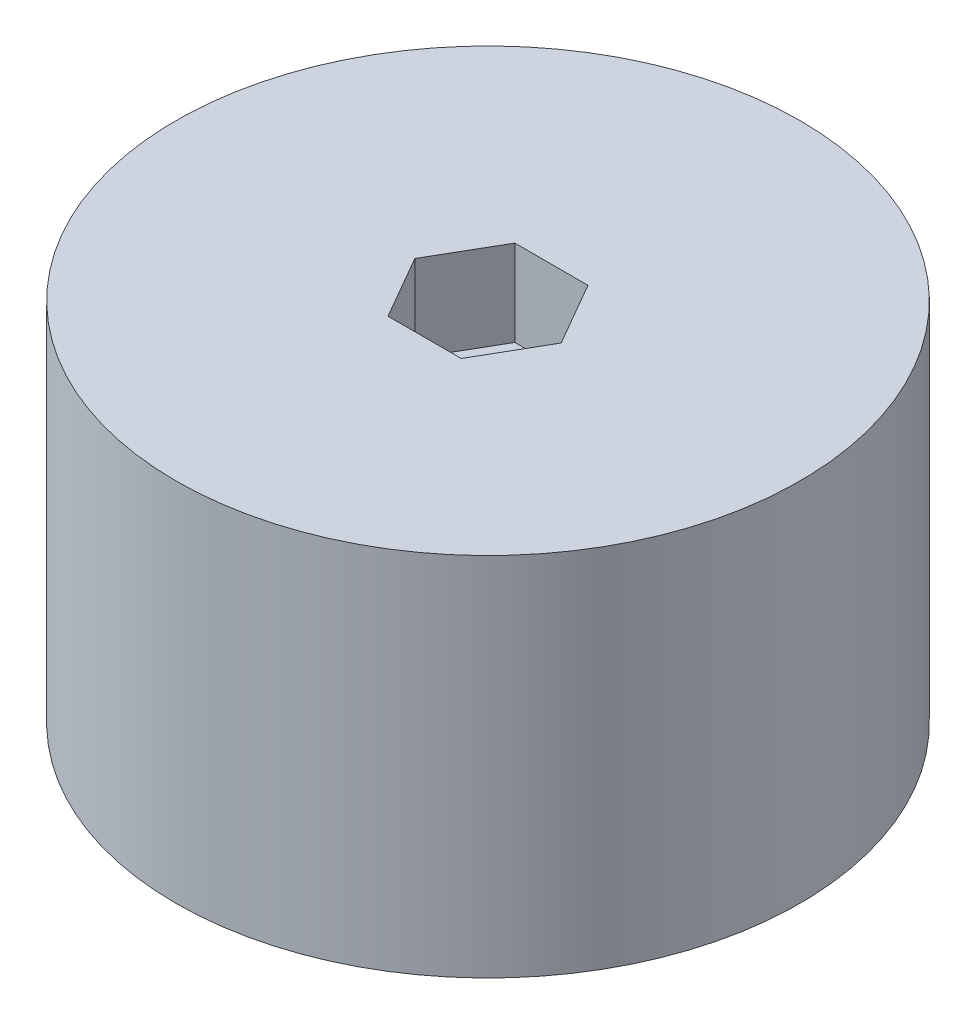
from build123d import *

# Parameters (mm, degrees)
SKETCH1_R           = 21.75
SKETCH1_R_2         = 3
BOSS_EXTRUDE1_DEPTH = 25.5
CUT_EXTRUDE1_DEPTH  = 6


with BuildPart() as part:
    # Sketch1 → Boss-Extrude1 (new body)
    with BuildSketch(Plane(origin=(0, 0, 0), x_dir=(1, 0, 0), z_dir=(0, 1, 0))):
        Circle(SKETCH1_R)
        Circle(SKETCH1_R_2, mode=Mode.SUBTRACT)
    extrude(amount=BOSS_EXTRUDE1_DEPTH)

    # Sketch2 → Cut-Extrude1 (cut)
    with BuildSketch(Plane(origin=(0, 25.5, 0), x_dir=(1, 0, 0), z_dir=(0, 1, 0))):
        Polygon((5.1, 0), (2.55, 4.416729559), (-2.55, 4.416729559), (-5.1, 0), (-2.55, -4.416729559), (2.55, -4.416729559), align=None)
    extrude(amount=-CUT_EXTRUDE1_DEPTH, mode=Mode.SUBTRACT)


solid = part.part
